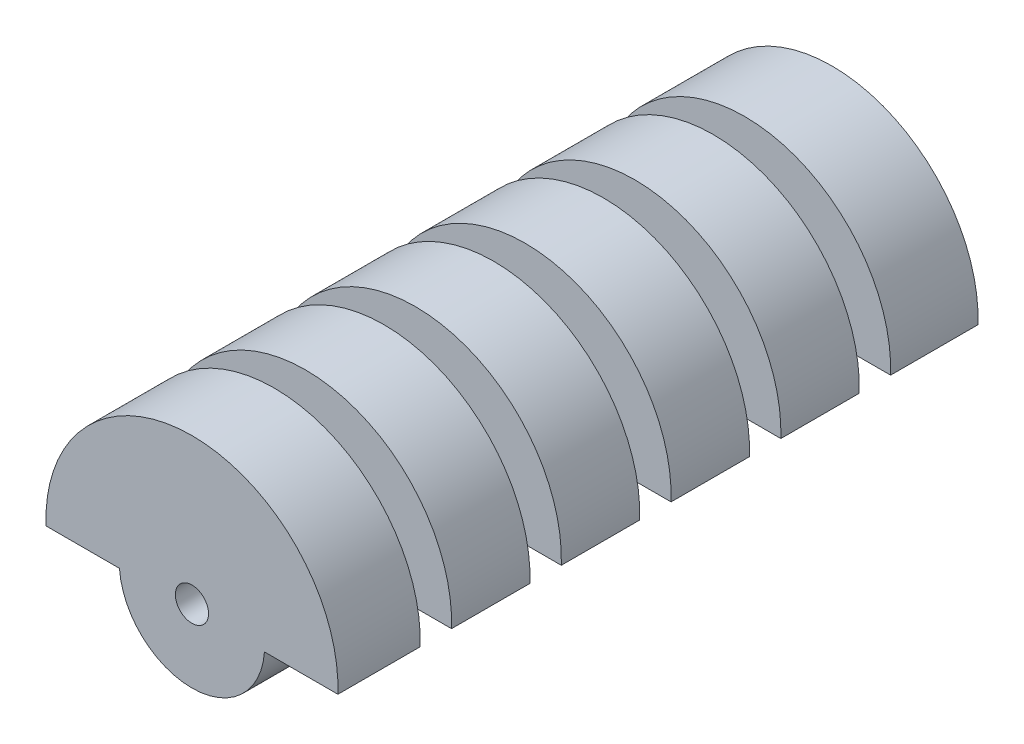
from build123d import *

# Parameters (mm, degrees)
SKETCH3_R            = 27.94
BOSS_EXTRUDE2_DEPTH  = 122.46
SKETCH5_R            = 3.175
CUT_EXTRUDE1_DEPTH   = 129.676877488
SKETCH4_W            = 14
SKETCH4_H            = 6
SHELL1_START         = 3
SHELL1_OUTLINE_R     = 10.94
SHELL1_OUTLINE_R_2   = 6.175
SHELL1_DEPTH         = 116.46
SHELL1_2_OUTLINE_R   = 24.94
SHELL1_2_OUTLINE_R_2 = 10.94
SHELL1_2_DEPTH       = 10.72
SHELL1_START_2       = 109.72
SHELL1_3_OUTLINE_R   = 24.94
SHELL1_3_OUTLINE_R_2 = 10.94
SHELL1_3_DEPTH       = 9.74
SHELL1_START_3       = 25.72
SHELL1_4_OUTLINE_R   = 24.94
SHELL1_4_OUTLINE_R_2 = 10.94
SHELL1_4_DEPTH       = 9
SHELL1_START_4       = 46.72
SHELL1_5_OUTLINE_R   = 24.94
SHELL1_5_OUTLINE_R_2 = 10.94
SHELL1_5_DEPTH       = 9
SHELL1_START_5       = 67.72
SHELL1_6_OUTLINE_R   = 24.94
SHELL1_6_OUTLINE_R_2 = 10.94
SHELL1_6_DEPTH       = 9
SHELL1_START_6       = 88.72
SHELL1_7_OUTLINE_R   = 24.94
SHELL1_7_OUTLINE_R_2 = 10.94
SHELL1_7_DEPTH       = 9
BOSS_EXTRUDE3_REACH  = 130.677
SKETCH13_W           = 16.483162312
SKETCH13_H           = 6
CUT_EXTRUDE3_DEPTH   = 123
BOSS_EXTRUDE5_START  = -122.46
BOSS_EXTRUDE5_DEPTH  = 122.46


# Read off the part's stored shape, not the designer's step: Shell1
with BuildPart() as part:
    # Sketch3 → Boss-Extrude2 (new body)
    with BuildSketch(Plane.XY):
        Circle(SKETCH3_R)
    extrude(amount=BOSS_EXTRUDE2_DEPTH)

    # Sketch5 → Cut-Extrude1 (cut, through all)
    with BuildSketch(Plane.XY.offset(122.46)):
        Circle(SKETCH5_R)
    extrude(amount=-CUT_EXTRUDE1_DEPTH, mode=Mode.SUBTRACT)

    # Sketch4 → Cut-Revolve1 (revolve, cut)
    with BuildSketch(Plane(origin=(0, 0, 0), x_dir=(1, 0, 0), z_dir=(0, 1, 0)), mode=Mode.PRIVATE) as cut_revolve1_sk:
        with Locations((-20.94, -103.72)):
            Rectangle(SKETCH4_W, SKETCH4_H)
        with Locations((-20.94, -82.72)):
            Rectangle(SKETCH4_W, SKETCH4_H)
        with Locations((-20.94, -61.72)):
            Rectangle(SKETCH4_W, SKETCH4_H)
        with Locations((-20.94, -40.72)):
            Rectangle(SKETCH4_W, SKETCH4_H)
        with Locations((-20.94, -19.72)):
            Rectangle(SKETCH4_W, SKETCH4_H)
    revolve(cut_revolve1_sk.sketch.rotate(Axis((0, 0, 122.46), (0, 0, -1)), 180), axis=Axis((0, 0, 122.46), (0, 0, -1)), mode=Mode.SUBTRACT)

    # Shell1 outline → Shell1 (cut)
    with BuildSketch(Plane.XY.offset(SHELL1_START)):
        Circle(SHELL1_OUTLINE_R)
        Circle(SHELL1_OUTLINE_R_2, mode=Mode.SUBTRACT)
    extrude(amount=SHELL1_DEPTH, mode=Mode.SUBTRACT)

    # Shell1 2 outline → Shell1 2 (cut)
    with BuildSketch(Plane.XY.offset(SHELL1_START)):
        Circle(SHELL1_2_OUTLINE_R)
        Circle(SHELL1_2_OUTLINE_R_2, mode=Mode.SUBTRACT)
    extrude(amount=SHELL1_2_DEPTH, mode=Mode.SUBTRACT)

    # Shell1 3 outline → Shell1 3 (cut)
    with BuildSketch(Plane.XY.offset(SHELL1_START_2)):
        Circle(SHELL1_3_OUTLINE_R)
        Circle(SHELL1_3_OUTLINE_R_2, mode=Mode.SUBTRACT)
    extrude(amount=SHELL1_3_DEPTH, mode=Mode.SUBTRACT)

    # Shell1 4 outline → Shell1 4 (cut)
    with BuildSketch(Plane.XY.offset(SHELL1_START_3)):
        Circle(SHELL1_4_OUTLINE_R)
        Circle(SHELL1_4_OUTLINE_R_2, mode=Mode.SUBTRACT)
    extrude(amount=SHELL1_4_DEPTH, mode=Mode.SUBTRACT)

    # Shell1 5 outline → Shell1 5 (cut)
    with BuildSketch(Plane.XY.offset(SHELL1_START_4)):
        Circle(SHELL1_5_OUTLINE_R)
        Circle(SHELL1_5_OUTLINE_R_2, mode=Mode.SUBTRACT)
    extrude(amount=SHELL1_5_DEPTH, mode=Mode.SUBTRACT)

    # Shell1 6 outline → Shell1 6 (cut)
    with BuildSketch(Plane.XY.offset(SHELL1_START_5)):
        Circle(SHELL1_6_OUTLINE_R)
        Circle(SHELL1_6_OUTLINE_R_2, mode=Mode.SUBTRACT)
    extrude(amount=SHELL1_6_DEPTH, mode=Mode.SUBTRACT)

    # Shell1 7 outline → Shell1 7 (cut)
    with BuildSketch(Plane.XY.offset(SHELL1_START_6)):
        Circle(SHELL1_7_OUTLINE_R)
        Circle(SHELL1_7_OUTLINE_R_2, mode=Mode.SUBTRACT)
    extrude(amount=SHELL1_7_DEPTH, mode=Mode.SUBTRACT)

    # Boss-Extrude3: up to this face of the body (flat: up to its plane)
    boss_extrude3_end = Plane(part.part.faces().sort_by_distance((-27.149737461, 0, 122.46))[0])
    # Sketch10 → Boss-Extrude3 (add, up to the picked face)
    with BuildSketch(Plane(origin=(0, 0, 0), x_dir=(-1, 0, 0), z_dir=(0, 0, -1)), mode=Mode.PRIVATE) as boss_extrude3_sk1:
        with BuildLine():
            Line((-1, 27.922098775), (-1, 3.01340754))
            ThreePointArc((-1, 3.01340754), (0, 3.175), (1, 3.01340754))
            Line((1, 3.01340754), (1, 27.922098775))
            ThreePointArc((1, 27.922098775), (0, 27.94), (-1, 27.922098775))
        make_face()
    boss_extrude3_tool1 = split(extrude(boss_extrude3_sk1.sketch, amount=-BOSS_EXTRUDE3_REACH, mode=Mode.PRIVATE), bisect_by=boss_extrude3_end, keep=Keep.BOTH, mode=Mode.PRIVATE)
    # Sketch10 → Boss-Extrude3 (add, up to the picked face)
    with BuildSketch(Plane(origin=(0, 0, 0), x_dir=(-1, 0, 0), z_dir=(0, 0, -1)), mode=Mode.PRIVATE) as boss_extrude3_sk2:
        with BuildLine():
            Line((3.01340754, 1), (27.922098775, 1))
            ThreePointArc((27.922098775, 1), (27.94, 0), (27.922098775, -1))
            Line((27.922098775, -1), (3.01340754, -1))
            ThreePointArc((3.01340754, -1), (3.175, 0), (3.01340754, 1))
        make_face()
    boss_extrude3_tool2 = split(extrude(boss_extrude3_sk2.sketch, amount=-BOSS_EXTRUDE3_REACH, mode=Mode.PRIVATE), bisect_by=boss_extrude3_end, keep=Keep.BOTH, mode=Mode.PRIVATE)
    # Sketch10 → Boss-Extrude3 (add, up to the picked face)
    with BuildSketch(Plane(origin=(0, 0, 0), x_dir=(-1, 0, 0), z_dir=(0, 0, -1)), mode=Mode.PRIVATE) as boss_extrude3_sk3:
        with BuildLine():
            Line((-1, -3.01340754), (-1, -27.922098775))
            ThreePointArc((-1, -27.922098775), (0, -27.94), (1, -27.922098775))
            Line((1, -27.922098775), (1, -3.01340754))
            ThreePointArc((1, -3.01340754), (0, -3.175), (-1, -3.01340754))
        make_face()
    boss_extrude3_tool3 = split(extrude(boss_extrude3_sk3.sketch, amount=-BOSS_EXTRUDE3_REACH, mode=Mode.PRIVATE), bisect_by=boss_extrude3_end, keep=Keep.BOTH, mode=Mode.PRIVATE)
    # Sketch10 → Boss-Extrude3 (add, up to the picked face)
    with BuildSketch(Plane(origin=(0, 0, 0), x_dir=(-1, 0, 0), z_dir=(0, 0, -1)), mode=Mode.PRIVATE) as boss_extrude3_sk4:
        with BuildLine():
            Line((-27.922098775, -1), (-3.01340754, -1))
            ThreePointArc((-3.01340754, -1), (-3.175, 0), (-3.01340754, 1))
            Line((-3.01340754, 1), (-27.922098775, 1))
            ThreePointArc((-27.922098775, 1), (-27.94, 0), (-27.922098775, -1))
        make_face()
    boss_extrude3_tool4 = split(extrude(boss_extrude3_sk4.sketch, amount=-BOSS_EXTRUDE3_REACH, mode=Mode.PRIVATE), bisect_by=boss_extrude3_end, keep=Keep.BOTH, mode=Mode.PRIVATE)
    add(boss_extrude3_tool1.solids().sort_by(Axis((0, 15.527819, 0), (0, 0, 1)))[0])
    add(boss_extrude3_tool2.solids().sort_by(Axis((-15.527819, 0, 0), (0, 0, 1)))[0])
    add(boss_extrude3_tool3.solids().sort_by(Axis((0, -15.527819, 0), (0, 0, 1)))[0])
    add(boss_extrude3_tool4.solids().sort_by(Axis((15.527819, 0, 0), (0, 0, 1)))[0])

    # Sketch13 → Cut-Revolve2 (revolve, cut)
    with BuildSketch(Plane(origin=(0, 0, 0), x_dir=(1, 0, 0), z_dir=(0, 1, 0)), mode=Mode.PRIVATE) as cut_revolve2_sk:
        with Locations((-22.145666886, -40.72)):
            Rectangle(SKETCH13_W, SKETCH13_H)
        with Locations((-22.145666886, -19.72)):
            Rectangle(SKETCH13_W, SKETCH13_H)
        with Locations((-22.145666886, -61.72)):
            Rectangle(SKETCH13_W, SKETCH13_H)
        with Locations((-22.145666886, -82.72)):
            Rectangle(SKETCH13_W, SKETCH13_H)
        with Locations((-22.145666886, -103.72)):
            Rectangle(SKETCH13_W, SKETCH13_H)
    revolve(cut_revolve2_sk.sketch.rotate(Axis((0, 0, 121.588746248), (0, 0, -1)), 180), axis=Axis((0, 0, 121.588746248), (0, 0, -1)), mode=Mode.SUBTRACT)

    # Sketch16 → Cut-Extrude3 (cut)
    with BuildSketch(Plane(origin=(0, 0, 0), x_dir=(-1, 0, 0), z_dir=(0, 0, -1))):
        with BuildLine():
            Line((-27.923120749, -0.971044624), (-6.098171639, -0.971044624))
            ThreePointArc((-6.098171639, -0.971044624), (-0.014665674, -6.174982584), (6.093490379, -1))
            Line((6.093490379, -1), (27.922098775, -1))
            ThreePointArc((27.922098775, -1), (-0.014486703, -27.939996244), (-27.923120749, -0.971044624))
        make_face()
    extrude(amount=-CUT_EXTRUDE3_DEPTH, mode=Mode.SUBTRACT)

    # Sketch18 → Boss-Extrude5 (add)
    with BuildSketch(Plane(origin=(0, 0, 0), x_dir=(-1, 0, 0), z_dir=(0, 0, -1)).offset(BOSS_EXTRUDE5_START)):
        with BuildLine():
            Line((-3.175, 0), (-13.90408573, 0))
            ThreePointArc((-13.90408573, 0), (0, -13.90408573), (13.90408573, 0))
            Line((13.90408573, 0), (3.175, 0))
            ThreePointArc((3.175, 0), (0, -3.175), (-3.175, 0))
        make_face()
    extrude(amount=BOSS_EXTRUDE5_DEPTH)


solid = part.part
